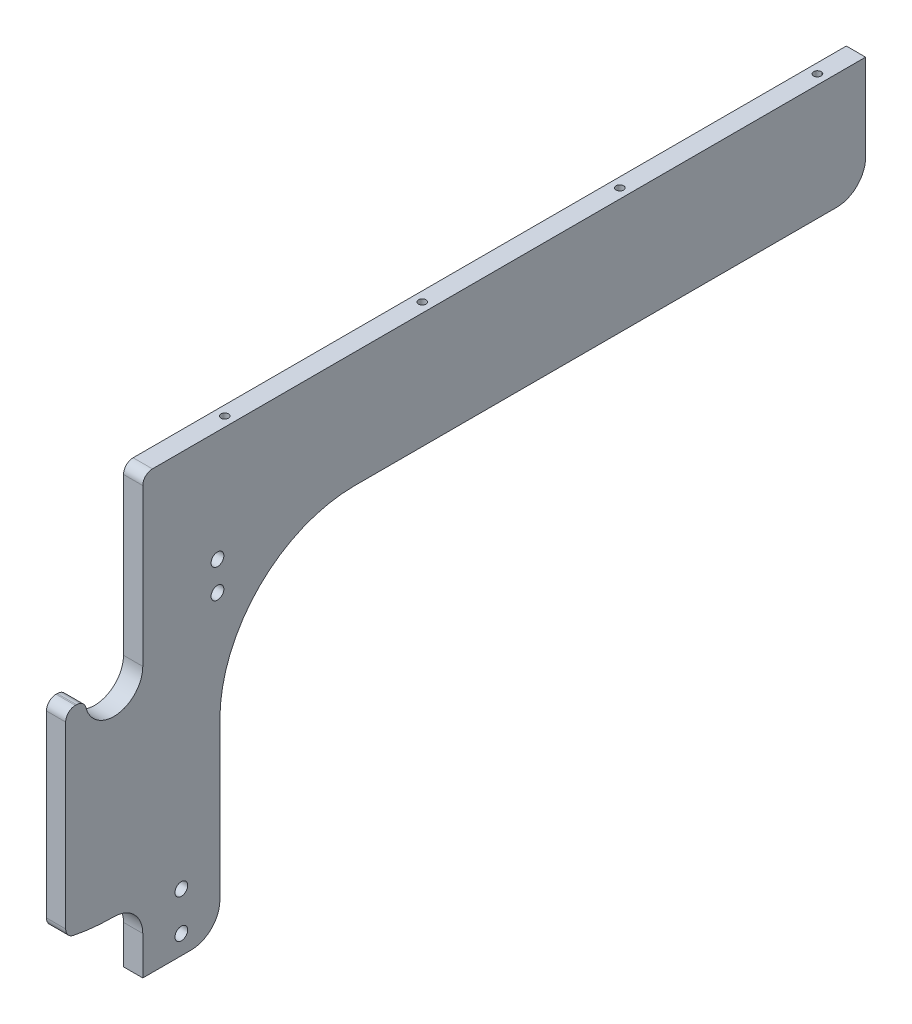
from build123d import *

# Parameters (mm, degrees)
SKETCH1_W                 = 12.7
SKETCH1_H                 = 287.3375
EXTRUDE1_DEPTH            = 263.525
EXTRUDE3_REACH            = 302.412
CUT_EXTRUDE4_REACH        = 302.412
SKETCH10_W                = 12.7
SKETCH10_H                = 109.5375
M6X1_0_TAPPED_HOLE1_D     = 5
M6X1_0_TAPPED_HOLE1_DEPTH = 14.986
M6X1_0_TAPPED_HOLE1_TIP   = 1.502151548
CUT_EXTRUDE1_REACH        = 302.412
FILLET2_R                 = 6.35
CUT_EXTRUDE2_REACH        = 302.412
CUT_EXTRUDE5_DEPTH        = 9.525
FILLET3_R                 = 4.7625
FILLET4_R                 = 19.05
M8_CLEARANCE_HOLE1_D      = 8.4


with BuildPart() as part:
    # Sketch1 → Extrude1 (new, symmetric)
    with BuildSketch(Plane.XY):
        Rectangle(SKETCH1_W, SKETCH1_H)
    extrude(amount=EXTRUDE1_DEPTH, both=True)

    # Sketch3 → Extrude3 (cut, up to next)
    with BuildSketch(Plane(origin=(6.35, 0, 0), x_dir=(0, 0, -1), z_dir=(1, 0, 0)), mode=Mode.PRIVATE) as extrude3_sk1:
        with BuildLine():
            Line((-250.825, 34.13125), (-250.825, 143.66875))
            Line((-250.825, 143.66875), (-212.725, 143.66875))
            Line((-212.725, 143.66875), (-212.725, 34.13125))
            ThreePointArc((-212.725, 34.13125), (-231.775, 15.08125), (-250.825, 34.13125))
        make_face()
    extrude3_tool1 = extrude(extrude3_sk1.sketch, amount=-EXTRUDE3_REACH, mode=Mode.PRIVATE) & part.part
    add(extrude3_tool1.solids().sort_by_distance((6.35, 81.346478, 231.775))[0], mode=Mode.SUBTRACT)

    # Sketch10 → Cut-Extrude4 (cut, up to next)
    with BuildSketch(Plane(origin=(6.35, 0, 0), x_dir=(0, 0, -1), z_dir=(1, 0, 0)), mode=Mode.PRIVATE) as cut_extrude4_sk1:
        with Locations((-257.175, 88.9)):
            Rectangle(SKETCH10_W, SKETCH10_H)
    cut_extrude4_tool1 = extrude(cut_extrude4_sk1.sketch, amount=-CUT_EXTRUDE4_REACH, mode=Mode.PRIVATE) & part.part
    add(cut_extrude4_tool1.solids().sort_by_distance((6.35, 88.9, 257.175))[0], mode=Mode.SUBTRACT)

    # M6x1.0 Tapped Hole1
    with Locations(Plane(origin=(0, 143.66875, 0), x_dir=(-1, 0, 0), z_dir=(0, 1, 0))):
        with Locations((0, -238.125), (0, -107.95), (0, 22.225), (0, 152.4)):
            Hole(M6X1_0_TAPPED_HOLE1_D / 2, depth=M6X1_0_TAPPED_HOLE1_DEPTH)
            with Locations((0, 0, -(M6X1_0_TAPPED_HOLE1_DEPTH + M6X1_0_TAPPED_HOLE1_TIP / 2))):  # 118° drill point
                Cone(0, M6X1_0_TAPPED_HOLE1_D / 2, M6X1_0_TAPPED_HOLE1_TIP, mode=Mode.SUBTRACT)

    # Sketch7 → Cut-Extrude1 (cut, up to next)
    with BuildSketch(Plane(origin=(6.35, 0, 0), x_dir=(0, 0, -1), z_dir=(1, 0, 0)), mode=Mode.PRIVATE) as cut_extrude1_sk1:
        with BuildLine():
            Line((-212.725, -118.26875), (-212.725, -143.66875))
            Line((-212.725, -143.66875), (-263.525, -143.66875))
            Line((-263.525, -143.66875), (-263.525, -95.383845645))
            ThreePointArc((-263.525, -95.383845645), (-247.765379853, -98.256552505), (-231.775, -99.21875))
            ThreePointArc((-231.775, -99.21875), (-218.304615818, -104.798365818), (-212.725, -118.26875))
        make_face()
    cut_extrude1_tool1 = extrude(cut_extrude1_sk1.sketch, amount=-CUT_EXTRUDE1_REACH, mode=Mode.PRIVATE) & part.part
    add(cut_extrude1_tool1.solids().sort_by_distance((6.35, -121.649289, 239.184335))[0], mode=Mode.SUBTRACT)

    # Fillet2
    fillet2_edges = [part.edges().sort_by_distance(p)[0] for p in [
        (0, 34.13125, 250.825),
        (0, 143.66875, 212.725),
        (0, 34.13125, 263.525),
        (0, -95.383845645, 263.525),
    ]]
    fillet(fillet2_edges, radius=FILLET2_R)

    # Sketch8 → Cut-Extrude2 (cut, up to next)
    with BuildSketch(Plane(origin=(6.35, 0, 0), x_dir=(0, 0, -1), z_dir=(1, 0, 0)), mode=Mode.PRIVATE) as cut_extrude2_sk1:
        with BuildLine():
            Line((263.525, 67.46875), (263.525, -143.66875))
            Line((263.525, -143.66875), (-161.925, -143.66875))
            Line((-161.925, -143.66875), (-161.925, -21.43125))
            ThreePointArc((-161.925, -21.43125), (-135.886792847, 41.430542847), (-73.025, 67.46875))
            Line((-73.025, 67.46875), (263.525, 67.46875))
        make_face()
    cut_extrude2_tool1 = extrude(cut_extrude2_sk1.sketch, amount=-CUT_EXTRUDE2_REACH, mode=Mode.PRIVATE) & part.part
    add(cut_extrude2_tool1.solids().sort_by_distance((6.35, -39.749452, -54.511595))[0], mode=Mode.SUBTRACT)

    # Sketch11 → Cut-Extrude5 (cut)
    with BuildSketch(Plane(origin=(-6.35, 0, 0), x_dir=(0, 0, -1), z_dir=(1, 0, 0))):
        with BuildLine():
            Line((-73.025, 80.16875), (244.475, 80.16875))
            ThreePointArc((244.475, 80.16875), (248.965128061, 82.028621939), (250.825, 86.51875))
            Line((250.825, 86.51875), (250.825, 118.26875))
            ThreePointArc((250.825, 118.26875), (248.965128061, 122.758878061), (244.475, 124.61875))
            Line((244.475, 124.61875), (-145.726120962, 124.61875))
            ThreePointArc((-145.726120962, 124.61875), (-151.402961913, 121.114093006), (-150.813541339, 114.46866396))
            Line((-150.813541339, 114.46866396), (-120.592046798, 74.009199222))
            ThreePointArc((-120.592046798, 74.009199222), (-117.151800564, 71.676641677), (-113.005824867, 71.971606717))
            ThreePointArc((-113.005824867, 71.971606717), (-93.431246072, 78.098369316), (-73.025, 80.16875))
        make_face()
        with BuildLine():
            Line((-200.025, 55.129680721), (-200.025, 34.13125))
            ThreePointArc((-200.025, 34.13125), (-209.324359697, 11.680609697), (-231.775, 2.38125))
            Line((-231.775, 2.38125), (-244.475, 2.38125))
            ThreePointArc((-244.475, 2.38125), (-248.965128061, 0.521378061), (-250.825, -3.96875))
            Line((-250.825, -3.96875), (-250.825, -73.81875))
            ThreePointArc((-250.825, -73.81875), (-248.965128061, -78.308878061), (-244.475, -80.16875))
            Line((-244.475, -80.16875), (-180.975, -80.16875))
            ThreePointArc((-180.975, -80.16875), (-176.484871939, -78.308878061), (-174.625, -73.81875))
            Line((-174.625, -73.81875), (-174.625, -21.43125))
            ThreePointArc((-174.625, -21.43125), (-172.189173753, 0.682696818), (-164.998491262, 21.73629458))
            ThreePointArc((-164.998491262, 21.73629458), (-164.42942747, 25.076814823), (-165.659414089, 28.234352156))
            Line((-165.659414089, 28.234352156), (-188.587579623, 58.929766761))
            ThreePointArc((-188.587579623, 58.929766761), (-195.677171397, 61.155774788), (-200.025, 55.129680721))
        make_face()
    extrude(amount=CUT_EXTRUDE5_DEPTH, mode=Mode.SUBTRACT)

    # Fillet3
    fillet3_edges = [part.edges().sort_by_distance(p)[0] for p in [
        (3.175, 124.61875, -49.374439519),
        (3.175, 102.39375, -250.825),
        (3.175, 80.16875, -85.725),
        (-6.35, 124.61875, -49.374439519),
        (-6.35, 102.39375, -250.825),
        (-6.35, 80.16875, -85.725),
        (-6.35, -80.16875, 212.725),
        (-6.35, -38.89375, 250.825),
        (-6.35, 11.680609697, 209.324359697),
        (3.175, -38.89375, 250.825),
        (3.175, -80.16875, 212.725),
        (3.175, 11.680609697, 209.324359697),
        (-6.35, 78.098369316, 93.431246072),
        (-6.35, -47.625, 174.625),
        (-6.35, -78.308878061, 176.484871939),
        (-6.35, 122.758878061, -248.965128061),
        (-6.35, 82.028621939, -248.965128061),
        (3.175, -78.308878061, 176.484871939),
        (3.175, -47.625, 174.625),
        (3.175, 78.098369316, 93.431246072),
        (3.175, 82.028621939, -248.965128061),
        (3.175, 122.758878061, -248.965128061),
        (-6.35, -78.308878061, 248.965128061),
        (3.175, -78.308878061, 248.965128061),
        (3.175, 94.238931591, 135.702794068),
        (-6.35, 71.676641677, 117.151800564),
        (-6.35, 94.238931591, 135.702794068),
        (-6.35, 121.114093006, 151.402961913),
        (3.175, 121.114093006, 151.402961913),
        (3.175, 71.676641677, 117.151800564),
        (-6.35, 0.521378061, 248.965128061),
        (-6.35, 2.38125, 238.125),
        (-6.35, 43.582059459, 177.123496856),
        (-6.35, 25.076814823, 164.42942747),
        (3.175, 2.38125, 238.125),
        (3.175, 0.521378061, 248.965128061),
        (3.175, 0.682696818, 172.189173753),
        (3.175, 25.076814823, 164.42942747),
        (3.175, 43.582059459, 177.123496856),
        (-6.35, 0.682696818, 172.189173753),
        (-6.35, 44.630465361, 200.025),
        (-6.35, 61.155774788, 195.677171397),
        (3.175, 61.155774788, 195.677171397),
        (3.175, 44.630465361, 200.025),
    ]]
    fillet(fillet3_edges, radius=FILLET3_R - 0.0001)  # a hair under: the kernel refuses the full size

    # Fillet4
    fillet4_edges = [part.edges().sort_by_distance(p)[0] for p in [
        (0, -143.66875, 161.925),
        (0, 67.46875, -263.525),
    ]]
    fillet(fillet4_edges, radius=FILLET4_R)

    # M8 Clearance Hole1 (through all)
    with Locations(Plane.ZY.offset(6.35)):
        with Locations((163.5125, 70.64375), (163.5125, 51.59375), (187.325, -105.56875), (187.325, -130.96875)):
            Hole(M8_CLEARANCE_HOLE1_D / 2)


solid = part.part
